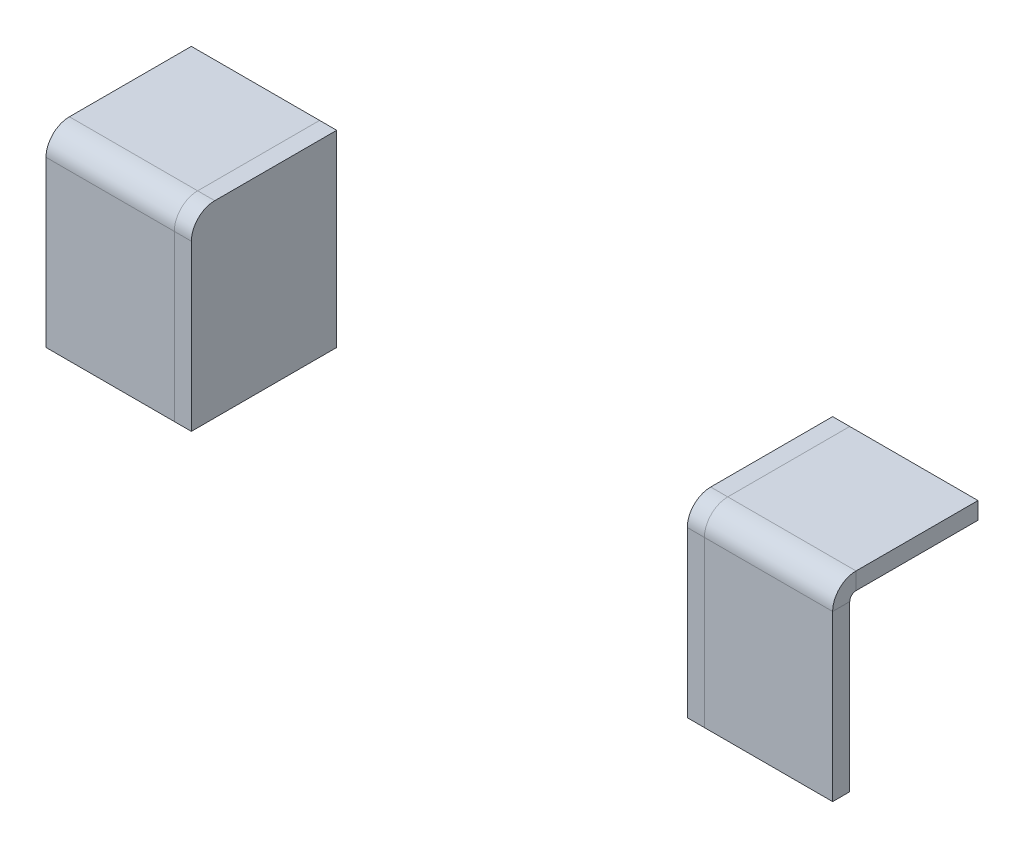
from build123d import *

# Parameters (mm, degrees)
SKETCH1_W                    = 15
SKETCH1_H                    = 17
BASE_FLANGE1_DEPTH           = 2
EDGE_FLANGE1_STRIP_W         = 9.4732
EDGE_FLANGE1_STRIP_H         = 2
EDGE_FLANGE1_STRIP_CUT_DEPTH = 15
EDGE_FLANGE1_DEPTH           = 15
BASE_FLANGE2_START           = 2
BASE_FLANGE2_DEPTH           = 2


# Sheet-metal steps are written as plain solids
with BuildPart() as part:
    # Sketch1 → Base-Flange1 (new body)
    with BuildSketch(Plane(origin=(0, 0, 0), x_dir=(1, 0, 0), z_dir=(0, 1, 0))):
        Rectangle(SKETCH1_W, SKETCH1_H)
    extrude(amount=-BASE_FLANGE1_DEPTH)

    # Edge-Flange1 strip (across the edge) → Edge-Flange1 strip cut (cut)
    with BuildSketch(Plane(origin=(7.5, -2, 8.5), x_dir=(0, 0, -1), z_dir=(-1, 0, 0))):
        with Locations((-2, -1)):
            Rectangle(EDGE_FLANGE1_STRIP_W, EDGE_FLANGE1_STRIP_H)
    extrude(amount=EDGE_FLANGE1_STRIP_CUT_DEPTH, mode=Mode.SUBTRACT)

    # Edge-Flange1 section (across the edge) → Edge-Flange1 (add)
    with BuildSketch(Plane(origin=(7.5, -2, 8.5), x_dir=(0, 0, -1), z_dir=(-1, 0, 0))):
        with BuildLine():
            Line((0, 0.7366), (0, 20))
            Line((0, 20), (2, 20))
            Line((2, 20), (2, 0.7366))
            ThreePointArc((2, 0.7366), (2.215745145, 0.215745145), (2.7366, 0))
            Line((2.7366, 0), (2.7366, -2))
            ThreePointArc((2.7366, -2), (0.801531583, -1.198468417), (0, 0.7366))
        make_face()
    extrude(amount=EDGE_FLANGE1_DEPTH)


with BuildPart() as body_2:
    # Sketch9 → Base-Flange2 (new body)
    with BuildSketch(Plane(origin=(7.5, 0, 0), x_dir=(0, 0, -1), z_dir=(1, 0, 0)).offset(BASE_FLANGE2_START)):
        with BuildLine():
            Line((-8.5, -22), (-8.5, -2.7366))
            ThreePointArc((-8.5, -2.7366), (-7.698468417, -0.801531583), (-5.7634, 0))
            Line((-5.7634, 0), (8.5, 0))
            Line((8.5, 0), (8.5, -22))
            Line((8.5, -22), (-8.5, -22))
        make_face()
    extrude(amount=-BASE_FLANGE2_DEPTH)


with BuildPart() as body_3:
    # Mirror1: mirrored copy
    add(part.part.mirror(Plane.ZY.offset(-38.5)))


with BuildPart() as body_4:
    # Mirror1 2: mirrored copy
    add(body_2.part.mirror(Plane.ZY.offset(-38.5)))


solid = Compound([part.part, body_2.part, body_3.part, body_4.part])
